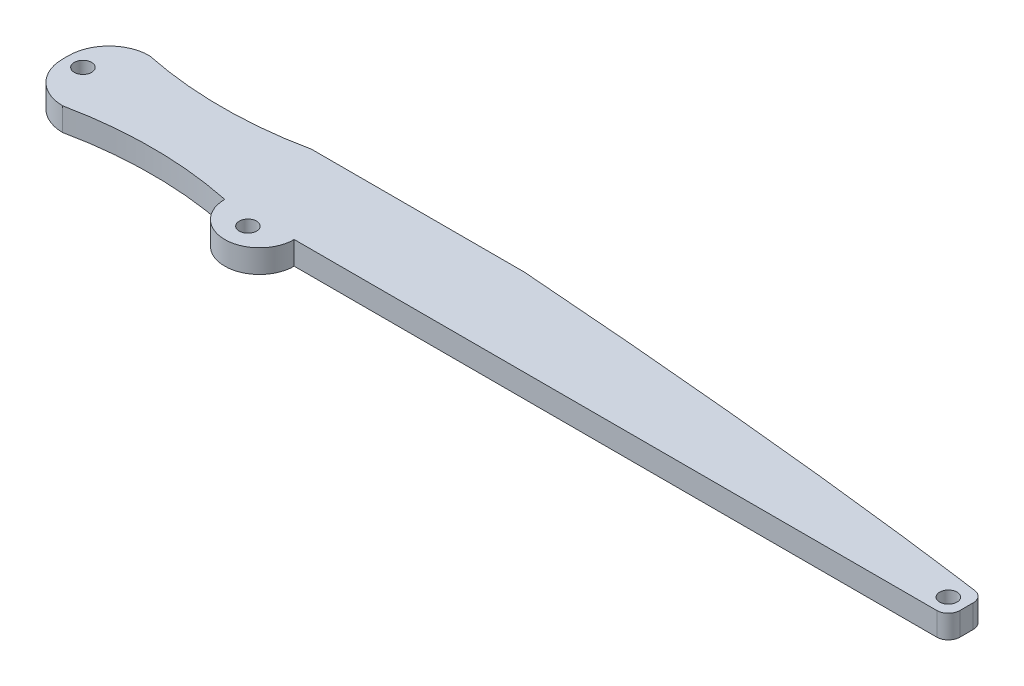
from build123d import *

# Parameters (mm, degrees)
SKETCH2_W           = 160
SKETCH2_H           = 15
BOSS_EXTRUDE1_DEPTH = 4
BOSS_EXTRUDE2_DEPTH = 4
SKETCH5_R           = 1.5
CUT_EXTRUDE1_DEPTH  = 82.229612827
CUT_EXTRUDE2_DEPTH  = 82.229612827
FILLET1_R           = 7
FILLET2_R           = 2
CUT_EXTRUDE3_DEPTH  = 82.229612947


with BuildPart() as part:
    # Sketch2 → Boss-Extrude1 (new body)
    with BuildSketch(Plane(origin=(0, 0, 0), x_dir=(1, 0, 0), z_dir=(0, 1, 0))):
        Rectangle(SKETCH2_W, SKETCH2_H)
    extrude(amount=BOSS_EXTRUDE1_DEPTH)

    # Sketch4 → Boss-Extrude2 (add)
    with BuildSketch(Plane(origin=(0, 0, 0), x_dir=(1, 0, 0), z_dir=(0, 1, 0))):
        with BuildLine():
            Line((-45, -7.5), (-33, -7.5))
            ThreePointArc((-33, -7.5), (-39, -13.5), (-45, -7.5))
        make_face()
    extrude(amount=BOSS_EXTRUDE2_DEPTH)

    # Sketch5 → Cut-Extrude1 (cut, through all)
    with BuildSketch(Plane(origin=(0, 4, 0), x_dir=(1, 0, 0), z_dir=(0, 1, 0))):
        with Locations(Location((-77, 0, 0), (0, 0, 270))):
            Circle(SKETCH5_R)
        with Locations(Location((-39, -9.5, 0), (0, 0, 270))):
            Circle(SKETCH5_R)
        with Locations(Location((77, -4.5, 0), (0, 0, 270))):
            Circle(SKETCH5_R)
    extrude(amount=-CUT_EXTRUDE1_DEPTH, mode=Mode.SUBTRACT)

    # Sketch6 → Cut-Extrude2 (cut, through all)
    with BuildSketch(Plane(origin=(0, 4, 0), x_dir=(1, 0, 0), z_dir=(0, 1, 0))):
        with BuildLine():
            Line((80, 7.5), (-8.231546833, 7.5))
            add(Edge.make_bspline(
                [(-8.231546833, 7.5), (14.290081903, 5.870335425), (49.538058278, 2.848640909), (69.508001123, -0.069415723), (80, -1.449425232)],
                knots=[0, 0, 0, 0, 0, 1, 1, 1, 1, 1], degree=4))
            Line((80, -1.449425232), (80, 7.5))
        make_face()
    extrude(amount=-CUT_EXTRUDE2_DEPTH, mode=Mode.SUBTRACT)

    # Fillet1
    fillet1_edges = [part.edges().sort_by_distance(p)[0] for p in [
        (-80, 2, -7.5),
        (-80, 2, 7.5),
    ]]
    fillet(fillet1_edges, radius=FILLET1_R)

    # Fillet2
    # the kernel refuses this fillet: 2 mm, written as the material it takes off along each edge
    with BuildSketch(Plane(origin=(-8.231546833, 4, -7.5), x_dir=(-1, 0, 0), z_dir=(0, -1, 0))) as fillet2_piece_1:
        with BuildLine():
            CenterArc((0.072290514, -2), FILLET2_R, 90, 4.141569808)
            Line((-0.072151683, -0.005222706), (-0.075040527, 0.03467284))
            ThreePointArc((-0.075040527, 0.03467284), (-0.038963722, 0.037284715), (-0.002886851, 0.03989569))
            Line((-0.002886851, 0.03989569), (0, 0.04))
            Line((0, 0.04), (0.072290514, 0.04))
            Line((0.072290514, 0.04), (0.072290514, 0))
        make_face()
    extrude(amount=4, mode=Mode.SUBTRACT)
    with BuildSketch(Plane(origin=(80, 0, 7.5), x_dir=(-1, 0, 0), z_dir=(0, 1, 0))) as fillet2_piece_2:
        with BuildLine():
            CenterArc((FILLET2_R, -FILLET2_R), FILLET2_R, 90, 90)
            Line((0, -FILLET2_R), (-FILLET2_R * 0.02, -FILLET2_R))
            Line((-FILLET2_R * 0.02, -FILLET2_R), (-FILLET2_R * 0.02, FILLET2_R * 0.02))
            Line((-FILLET2_R * 0.02, FILLET2_R * 0.02), (FILLET2_R, FILLET2_R * 0.02))
            Line((FILLET2_R, FILLET2_R * 0.02), (FILLET2_R, 0))
        make_face()
    extrude(amount=4, mode=Mode.SUBTRACT)
    with BuildSketch(Plane(origin=(80, 4, 1.449425232), x_dir=(-0.9912995401068606, 0, -0.13162530829565738), z_dir=(0, -1, 0))) as fillet2_piece_3:
        with BuildLine():
            CenterArc((1.751992616, -1.999999306), FILLET2_R, 90.047746208, 82.388731024)
            Line((-0.230606464, -1.736748689), (-0.270258446, -1.731483677))
            Line((-0.270258446, -1.731483677), (-0.039651982, 0.005265012))
            Line((-0.039651982, 0.005265012), (4.9175e-05, 0.03999997))
            ThreePointArc((4.9175e-05, 0.03999997), (0.875159086, 0.039555606), (1.750292626, 0.039999986))
            Line((1.750292626, 0.039999986), (1.750325959, 0))
        make_face()
    extrude(amount=4, mode=Mode.SUBTRACT)

    # Sketch7 → Cut-Extrude3 (cut, through all)
    with BuildSketch(Plane(origin=(0, 4, 0), x_dir=(1, 0, 0), z_dir=(0, 1, 0))):
        with BuildLine():
            Line((-73, -7.5), (-45, -7.5))
            ThreePointArc((-45, -7.5), (-59, -6.045404943), (-73, -7.5))
        make_face()
        with BuildLine():
            Line((-73, 7.5), (-45, 7.5))
            ThreePointArc((-45, 7.5), (-59, 6.045404943), (-73, 7.5))
        make_face()
    extrude(amount=-CUT_EXTRUDE3_DEPTH, mode=Mode.SUBTRACT)


solid = part.part
